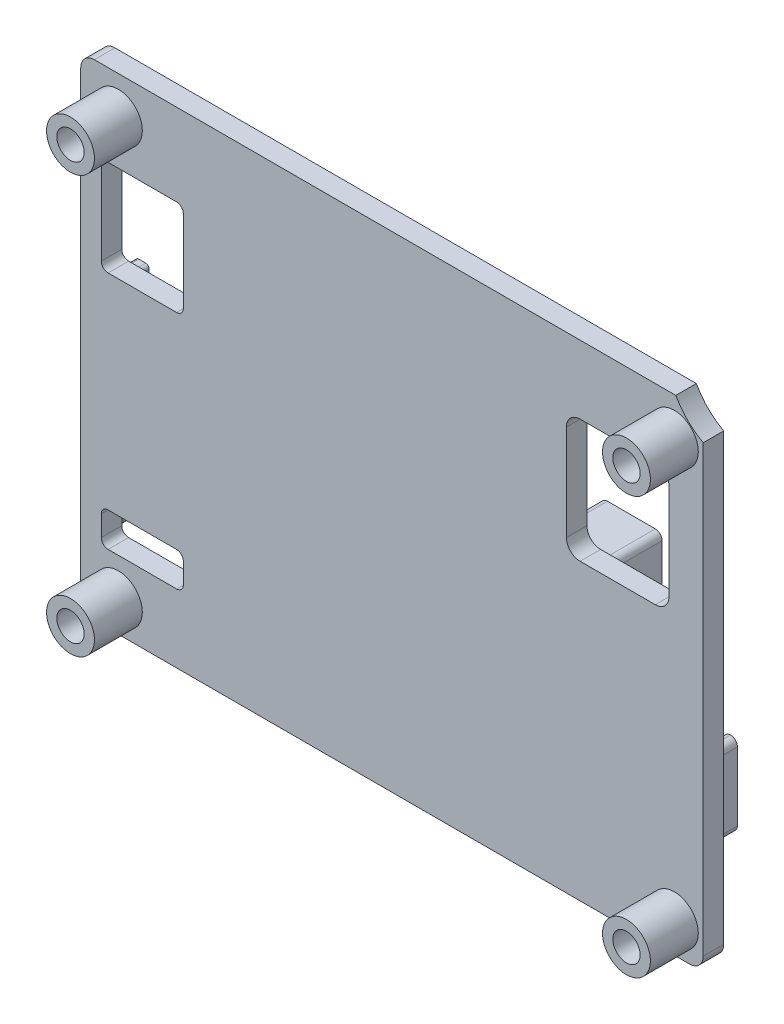
from build123d import *

# Parameters (mm, degrees)
SKETCH1_W            = 91
SKETCH1_H            = 71
BOSS_EXTRUDE1_DEPTH  = 3
SKETCH3_W            = 4
SKETCH3_H            = 4
CUT_EXTRUDE1_DEPTH   = 5
FILLET2_R            = 10
FILLET3_R            = 2
SKETCH4_W            = 15
SKETCH4_H            = 18
CUT_EXTRUDE2_DEPTH   = 5
SKETCH5_R            = 3.5
SKETCH5_R_2          = 2
BOSS_EXTRUDE2_DEPTH  = 7
LPATTERN1_COUNT      = 2
LPATTERN1_PITCH      = 81.28
LPATTERN1_COUNT_DIR2 = 2
LPATTERN1_PITCH_DIR2 = 60.96
FILLET4_R            = 2
BOSS_EXTRUDE4_DEPTH  = 9
FILLET5_R            = 1
BOSS_EXTRUDE5_DEPTH  = 5
FILLET6_R            = 1
SKETCH9_W            = 25
SKETCH9_H            = 3
BOSS_EXTRUDE6_DEPTH  = 7
FILLET7_R            = 1
SKETCH10_W           = 12
SKETCH10_H           = 14
CUT_EXTRUDE3_DEPTH   = 5
FILLET8_R            = 1
CUT_EXTRUDE4_REACH   = 60.57
SKETCH11_W           = 12
SKETCH11_H           = 5
FILLET9_R            = 1
SKETCH12_W           = 2
SKETCH12_H           = 31
BOSS_EXTRUDE7_DEPTH  = 5
FILLET10_R           = 0.5


# Some blends are built 0.0001 mm under size
with BuildPart() as part:
    # Sketch1 → Boss-Extrude1 (new body)
    with BuildSketch(Plane.XY):
        Rectangle(SKETCH1_W, SKETCH1_H)
    extrude(amount=BOSS_EXTRUDE1_DEPTH)

    # Sketch3 → Cut-Extrude1 (cut)
    with BuildSketch(Plane(origin=(0, 0, 0), x_dir=(-1, 0, 0), z_dir=(0, 0, -1))):
        with Locations((-43.5, 33.5)):
            Rectangle(SKETCH3_W, SKETCH3_H)
        with Locations((43.5, -33.5)):
            Rectangle(SKETCH3_W, SKETCH3_H)
    extrude(amount=-CUT_EXTRUDE1_DEPTH, mode=Mode.SUBTRACT)

    # Fillet2
    # the kernel refuses this fillet: 10 mm, written as the material it adds along each edge
    with BuildSketch(Plane(origin=(-41.5, -31.5, 0), x_dir=(0, -1, 0), z_dir=(0, 0, 1))) as fillet2_piece_1:
        with BuildLine():
            CenterArc((8.782329983, -8.782329983), FILLET2_R, 118.570059811, 32.859880379)
            Line((0, -4), (0, 0))
            Line((0, 0), (4, 0))
        make_face()
    extrude(amount=3)
    with BuildSketch(Plane(origin=(41.5, 31.5, 0), x_dir=(1, 0, 0), z_dir=(0, 0, 1))) as fillet2_piece_2:
        with BuildLine():
            CenterArc((8.782329983, 8.782329983), FILLET2_R, 208.570059811, 32.859880379)
            Line((0, 4), (0, 0))
            Line((0, 0), (4, 0))
        make_face()
    extrude(amount=3)

    # Fillet3
    fillet3_edges = [part.edges().sort_by_distance(p)[0] for p in [
        (-45.5, 35.5, 1.5),
        (45.5, -35.5, 1.5),
    ]]
    fillet(fillet3_edges, radius=FILLET3_R)

    # Sketch4 → Cut-Extrude2 (cut)
    with BuildSketch(Plane.XY.offset(3)):
        with Locations((33, 16.5)):
            Rectangle(SKETCH4_W, SKETCH4_H)
    extrude(amount=-CUT_EXTRUDE2_DEPTH, mode=Mode.SUBTRACT)

    # Sketch5 → Boss-Extrude2 (add)
    with BuildSketch(Plane.XY.offset(3)):
        with Locations((-40, 30)):
            Circle(SKETCH5_R)
        with Locations((-40, 30)):
            Circle(SKETCH5_R_2, mode=Mode.SUBTRACT)
    boss_extrude2 = extrude(amount=BOSS_EXTRUDE2_DEPTH)

    # LPattern1: Boss-Extrude2 2 × 2
    with Locations(*[(i * LPATTERN1_PITCH, -j * LPATTERN1_PITCH_DIR2, 0) for i in range(LPATTERN1_COUNT) for j in range(LPATTERN1_COUNT_DIR2) if (i, j) != (0, 0)]):
        add(boss_extrude2)

    # Fillet4
    fillet4_edges = [part.edges().sort_by_distance(p)[0] for p in [
        (25.5, 7.5, 1.5),
        (25.5, 25.5, 1.5),
        (40.5, 25.5, 1.5),
        (40.5, 7.5, 1.5),
    ]]
    fillet(fillet4_edges, radius=FILLET4_R)

    # Sketch7 → Boss-Extrude4 (add)
    with BuildSketch(Plane(origin=(0, 0, 0), x_dir=(-1, 0, 0), z_dir=(0, 0, -1))):
        Polygon((-24.5, 2.1), (-18.5, 2.1), (-18.5, 5.1), (-27.5, 5.1), (-27.5, -20.5), (-24.5, -20.5), align=None)
    boss_extrude4 = extrude(amount=BOSS_EXTRUDE4_DEPTH)

    # Mirror1: Boss-Extrude4 across plane
    add(boss_extrude4.mirror(Plane(origin=(-0.5, 0, 0), x_dir=(0, 0, 1), z_dir=(1, 0, 0))))

    # Fillet5
    fillet5_edges = [part.edges().sort_by_distance(p)[0] for p in [
        (24.5, -20.5, -4.5),
        (24.5, 2.1, -4.5),
        (18.5, 2.1, -4.5),
        (18.5, 5.1, -4.5),
        (27.5, 5.1, -4.5),
        (27.5, -20.5, -4.5),
        (-25.5, 2.1, -4.5),
        (-25.5, -20.5, -4.5),
        (-28.5, -20.5, -4.5),
        (-28.5, 5.1, -4.5),
        (-19.5, 5.1, -4.5),
        (-19.5, 2.1, -4.5),
    ]]
    fillet(fillet5_edges, radius=FILLET5_R)

    # Sketch8 → Boss-Extrude5 (add)
    with BuildSketch(Plane(origin=(0, 0, 0), x_dir=(-1, 0, 0), z_dir=(0, 0, -1))):
        Polygon((-40.5, -11.5), (-40.5, -21.5), (-36.5, -21.5), (-36.5, -23.5), (-42.5, -23.5), (-42.5, -11.5), align=None)
    extrude(amount=BOSS_EXTRUDE5_DEPTH)

    # Fillet6
    fillet6_edges = [part.edges().sort_by_distance(p)[0] for p in [
        (40.5, -11.5, -2.5),
        (40.5, -21.5, -2.5),
        (42.5, -11.5, -2.5),
        (42.5, -23.5, -2.5),
        (36.5, -23.5, -2.5),
        (36.5, -21.5, -2.5),
    ]]
    fillet(fillet6_edges, radius=FILLET6_R - 0.0001)  # a hair under: the kernel refuses the full size

    # Sketch9 → Boss-Extrude6 (add)
    with BuildSketch(Plane(origin=(0, 0, 0), x_dir=(-1, 0, 0), z_dir=(0, 0, -1))):
        with Locations((13, 13.8)):
            Rectangle(SKETCH9_W, SKETCH9_H)
    extrude(amount=BOSS_EXTRUDE6_DEPTH)

    # Fillet7
    fillet7_edges = [part.edges().sort_by_distance(p)[0] for p in [
        (-0.5, 15.3, -3.5),
        (-0.5, 12.3, -3.5),
        (-25.5, 12.3, -3.5),
        (-25.5, 15.3, -3.5),
    ]]
    fillet(fillet7_edges, radius=FILLET7_R)

    # Sketch10 → Cut-Extrude3 (cut)
    with BuildSketch(Plane(origin=(0, 0, 0), x_dir=(-1, 0, 0), z_dir=(0, 0, -1))):
        with Locations((36.5, 16.5)):
            Rectangle(SKETCH10_W, SKETCH10_H)
    extrude(amount=-CUT_EXTRUDE3_DEPTH, mode=Mode.SUBTRACT)

    # Fillet8
    fillet8_edges = [part.edges().sort_by_distance(p)[0] for p in [
        (-30.5, 9.5, 1.5),
        (-30.5, 23.5, 1.5),
        (-42.5, 23.5, 1.5),
        (-42.5, 9.5, 1.5),
    ]]
    fillet(fillet8_edges, radius=FILLET8_R)

    # Sketch11 → Cut-Extrude4 (cut, up to next)
    with BuildSketch(Plane(origin=(0, 0, 0), x_dir=(-1, 0, 0), z_dir=(0, 0, -1)), mode=Mode.PRIVATE) as cut_extrude4_sk1:
        with Locations((36.5, -23)):
            Rectangle(SKETCH11_W, SKETCH11_H)
    cut_extrude4_tool1 = extrude(cut_extrude4_sk1.sketch, amount=-CUT_EXTRUDE4_REACH, mode=Mode.PRIVATE) & part.part
    add(cut_extrude4_tool1.solids().sort_by_distance((-36.5, -23, 0))[0], mode=Mode.SUBTRACT)

    # Fillet9
    fillet9_edges = [part.edges().sort_by_distance(p)[0] for p in [
        (-30.5, -25.5, 1.5),
        (-30.5, -20.5, 1.5),
        (-42.5, -20.5, 1.5),
        (-42.5, -25.5, 1.5),
    ]]
    fillet(fillet9_edges, radius=FILLET9_R)

    # Sketch12 → Boss-Extrude7 (add)
    with BuildSketch(Plane(origin=(0, 0, 0), x_dir=(-1, 0, 0), z_dir=(0, 0, -1))):
        with Locations((44.5, -10)):
            Rectangle(SKETCH12_W, SKETCH12_H)
    extrude(amount=BOSS_EXTRUDE7_DEPTH)

    # Fillet10
    fillet10_edges = [part.edges().sort_by_distance(p)[0] for p in [
        (-43.5, 5.5, -2.5),
        (-43.5, -25.5, -2.5),
        (-45.5, -25.5, -2.5),
        (-45.5, 5.5, -2.5),
    ]]
    fillet(fillet10_edges, radius=FILLET10_R)


solid = part.part
